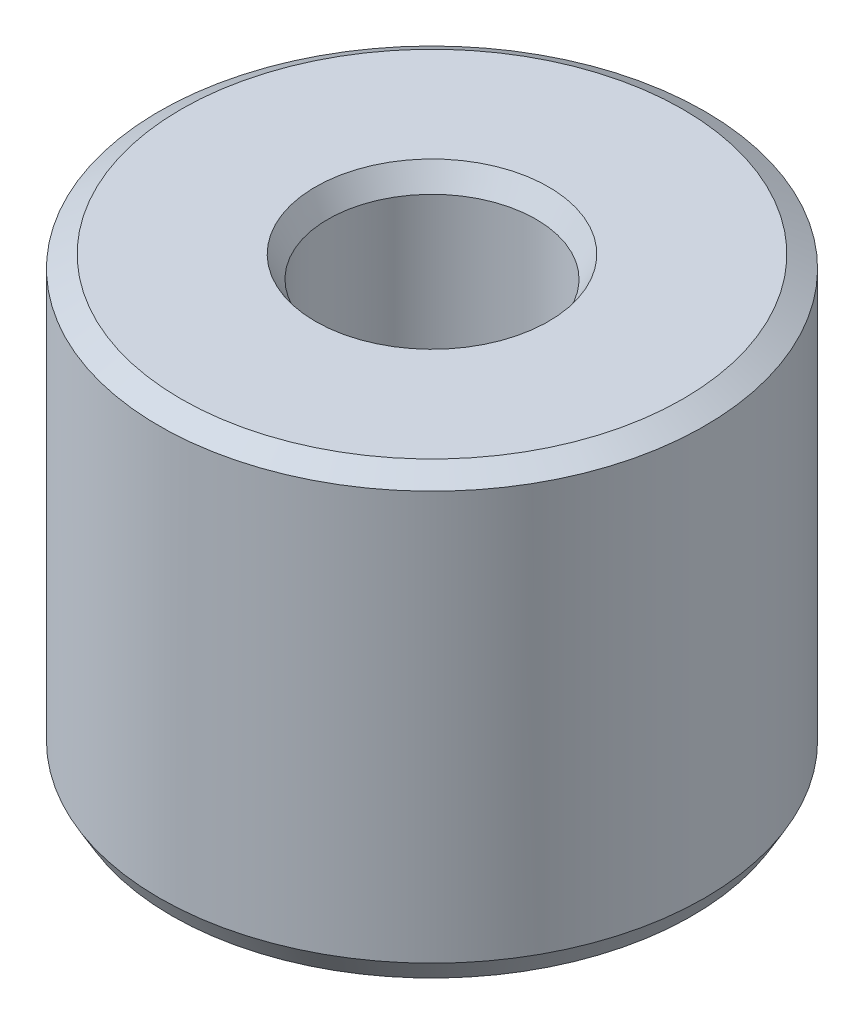
from build123d import *
from OCP.BRepFilletAPI import BRepFilletAPI_MakeChamfer

# Parameters (mm, degrees)
SKETCH1_R           = 30
BOSS_EXTRUDE1_DEPTH = 48.745940151
SKETCH2_R           = 11.44528089
CUT_EXTRUDE1_DEPTH  = 65.623267336
CHAMFER1_SIZE       = 1.380004822
CHAMFER1_SIZE2      = 2.390238467


with BuildPart() as part:
    # Sketch1 → Boss-Extrude1 (new body)
    with BuildSketch(Plane(origin=(0, 0, 0), x_dir=(1, 0, 0), z_dir=(0, 1, 0))):
        Circle(SKETCH1_R)
    extrude(amount=BOSS_EXTRUDE1_DEPTH)

    # Sketch2 → Cut-Extrude1 (cut, through all)
    with BuildSketch(Plane(origin=(0, 0, 0), x_dir=(1, 0, 0), z_dir=(0, 1, 0))):
        Circle(SKETCH2_R)
    extrude(amount=CUT_EXTRUDE1_DEPTH, mode=Mode.SUBTRACT)

    # Chamfer1: one chamfer whose edges measure the first distance from different faces: ONE call of the kernel's chamfer builder (chamfer() names one face for all edges)
    chamfer1_edges_1 = [part.edges().sort_by_distance(p)[0] for p in [
        (-11.44528089, 48.745940151, 0),
    ]]
    chamfer1_side_1 = [part.faces().sort_by_distance(p)[0] for p in [
        (-29.151471863, 48.745940151, 0),
    ]]
    chamfer1_edges_2 = [part.edges().sort_by_distance(p)[0] for p in [
        (-11.44528089, 0, 0),
    ]]
    chamfer1_side_2 = [part.faces().sort_by_distance(p)[0] for p in [
        (-11.44528089, 24.372970075, 0),
    ]]
    chamfer1_edges_3 = [part.edges().sort_by_distance(p)[0] for p in [
        (-30, 0, 0),
    ]]
    chamfer1_side_3 = [part.faces().sort_by_distance(p)[0] for p in [
        (-29.151471863, 0, 0),
    ]]
    chamfer1_edges_4 = [part.edges().sort_by_distance(p)[0] for p in [
        (-30, 48.745940151, 0),
    ]]
    chamfer1_side_4 = [part.faces().sort_by_distance(p)[0] for p in [
        (-30, 24.372970075, 0),
    ]]
    chamfer1 = BRepFilletAPI_MakeChamfer(part.part.solid().wrapped)
    for e in chamfer1_edges_1:
        chamfer1.Add(CHAMFER1_SIZE, CHAMFER1_SIZE2, e.wrapped, chamfer1_side_1[0].wrapped)  # the first distance lies on this face
    for e in chamfer1_edges_2:
        chamfer1.Add(CHAMFER1_SIZE, CHAMFER1_SIZE2, e.wrapped, chamfer1_side_2[0].wrapped)  # the first distance lies on this face
    for e in chamfer1_edges_3:
        chamfer1.Add(CHAMFER1_SIZE, CHAMFER1_SIZE2, e.wrapped, chamfer1_side_3[0].wrapped)  # the first distance lies on this face
    for e in chamfer1_edges_4:
        chamfer1.Add(CHAMFER1_SIZE, CHAMFER1_SIZE2, e.wrapped, chamfer1_side_4[0].wrapped)  # the first distance lies on this face
    add(Compound.cast(chamfer1.Shape()), mode=Mode.REPLACE)


solid = part.part
